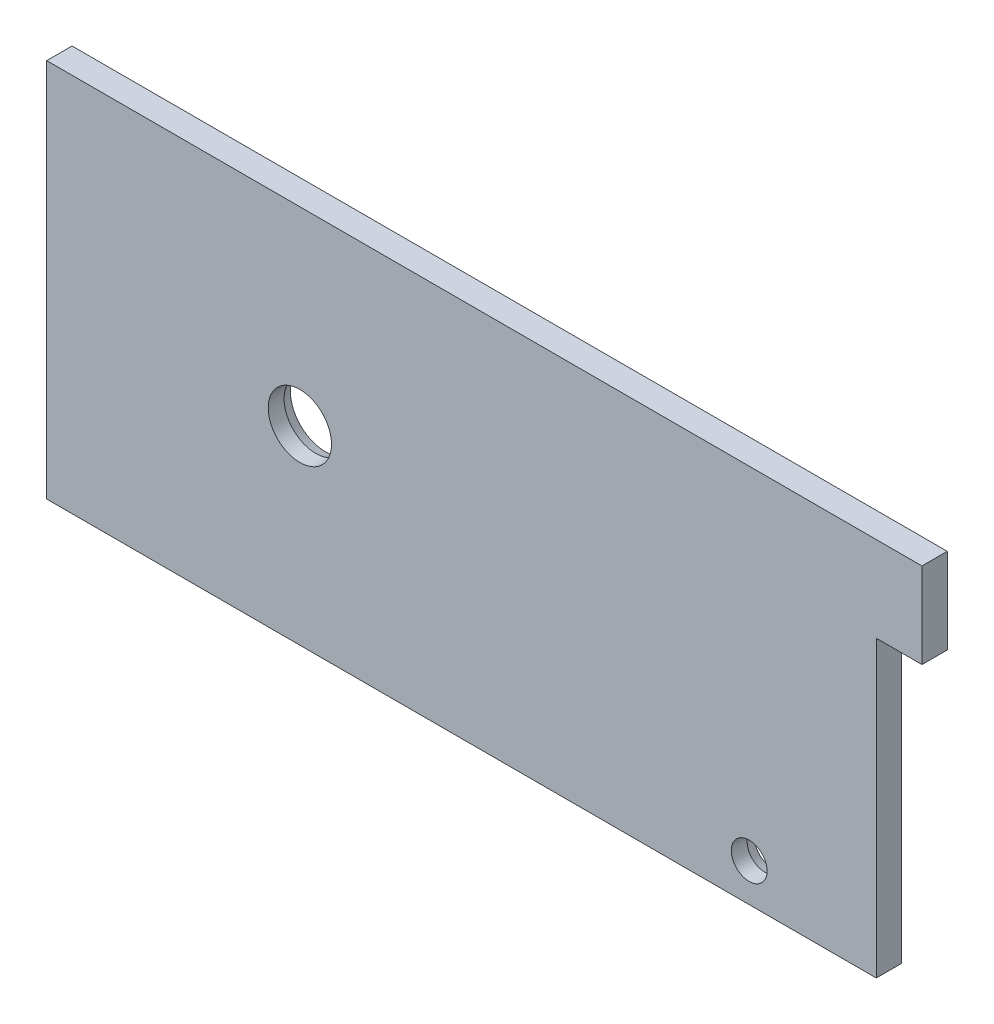
from build123d import *
from OCP.BRepFilletAPI import BRepFilletAPI_MakeChamfer

# Parameters (mm, degrees)
SKETCH1_R           = 5
SKETCH1_R_2         = 2.83
BOSS_EXTRUDE1_DEPTH = 2
CHAMFER1_SIZE       = 1.5
CHAMFER1_SIZE2      = 0.5


with BuildPart() as part:
    # Sketch1 → Boss-Extrude1 (new, symmetric)
    with BuildSketch(Plane.XY):
        Polygon((-81, -30), (50.07973639, -30), (50.07973639, 16.5), (57.3, 16.5), (57.3, 30), (-81, 30), align=None)
        with Locations((-41, 0)):
            Circle(SKETCH1_R, mode=Mode.SUBTRACT)
        with Locations((30, -24)):
            Circle(SKETCH1_R_2, mode=Mode.SUBTRACT)
    extrude(amount=BOSS_EXTRUDE1_DEPTH, both=True)

    # Chamfer1: one chamfer whose edges measure the first distance from different faces: ONE call of the kernel's chamfer builder (chamfer() names one face for all edges)
    chamfer1_edges_1 = [part.edges().sort_by_distance(p)[0] for p in [
        (27.17, -24, -2),
    ]]
    chamfer1_side_1 = [part.faces().sort_by_distance(p)[0] for p in [
        (27.17, -24, 0),
    ]]
    chamfer1_edges_2 = [part.edges().sort_by_distance(p)[0] for p in [
        (-46, 0, -2),
    ]]
    chamfer1_side_2 = [part.faces().sort_by_distance(p)[0] for p in [
        (-46, 0, 0),
    ]]
    chamfer1 = BRepFilletAPI_MakeChamfer(part.part.solid().wrapped)
    for e in chamfer1_edges_1:
        chamfer1.Add(CHAMFER1_SIZE, CHAMFER1_SIZE2, e.wrapped, chamfer1_side_1[0].wrapped)  # the first distance lies on this face
    for e in chamfer1_edges_2:
        chamfer1.Add(CHAMFER1_SIZE, CHAMFER1_SIZE2, e.wrapped, chamfer1_side_2[0].wrapped)  # the first distance lies on this face
    add(Compound.cast(chamfer1.Shape()), mode=Mode.REPLACE)


solid = part.part
